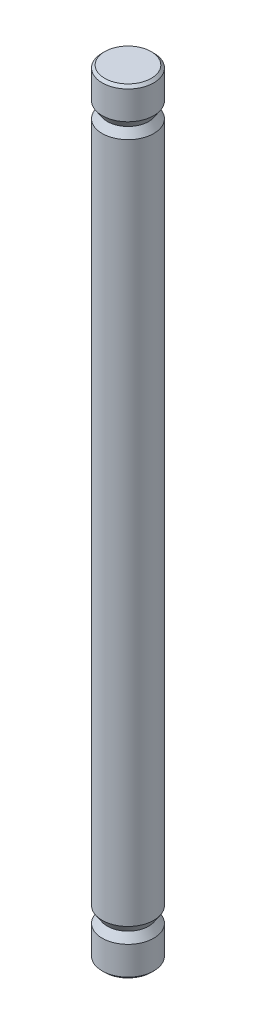
from build123d import *

# Parameters (mm, degrees)
ESQUISSE1_R        = 2.5
BOSS_EXTRU_1_DEPTH = 75
CHANFREIN1_SIZE    = 0.25


with BuildPart() as part:
    # Esquisse1 → Boss.-Extru.1 (new body)
    with BuildSketch(Plane(origin=(0, 0, 0), x_dir=(1, 0, 0), z_dir=(0, 1, 0))):
        Circle(ESQUISSE1_R)
    extrude(amount=BOSS_EXTRU_1_DEPTH)

    # Chanfrein1
    chanfrein1_edges = [part.edges().sort_by_distance(p)[0] for p in [
        (-2.5, 0, 0),
        (-2.5, 75, 0),
    ]]
    chamfer(chanfrein1_edges, length=CHANFREIN1_SIZE)

    # Esquisse2 → Enlèvement de matière-Révolution1 (revolve, cut)
    with BuildSketch(Plane.XY):
        Polygon((2.5, 72), (2, 71.25), (2.5, 70.5), align=None)
        Polygon((2, 3.75), (2.5, 4.5), (2.5, 3), align=None)
    revolve(axis=Axis((0, 74.75, 0), (0, -1, 0)), mode=Mode.SUBTRACT)


solid = part.part
